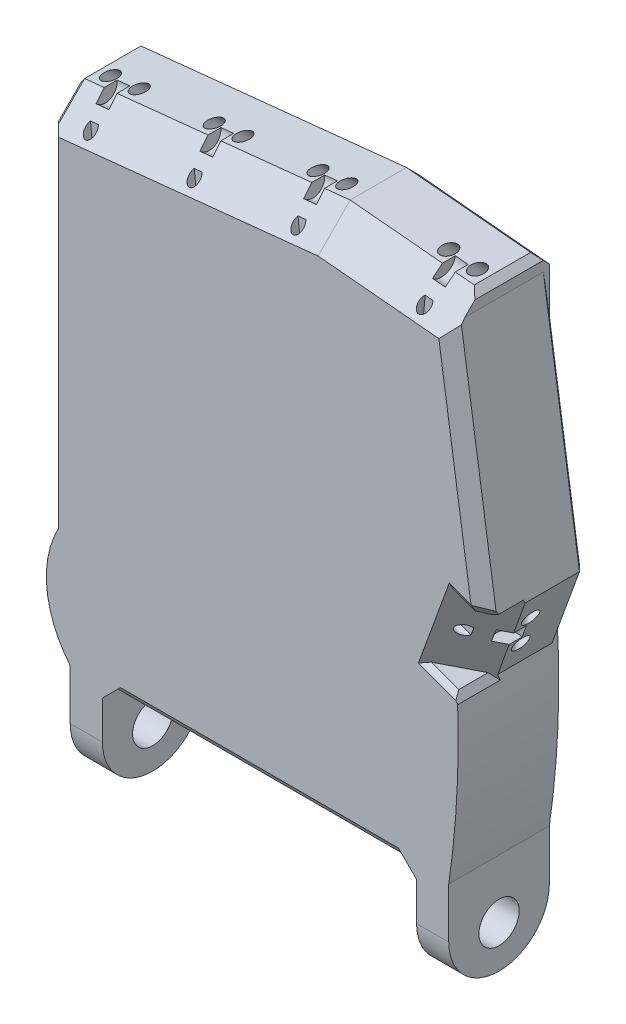
from build123d import *

# Parameters (mm, degrees)
SKETCH2_W                = 90
SKETCH2_H                = 120
BOSS_EXTRUDE1_DEPTH      = 12.5
SKETCH5_R                = 1.6
CUT_EXTRUDE1_DEPTH       = 156.95939029
SKETCH6_R                = 1.6
CUT_EXTRUDE2_DEPTH       = 155.009726207
SKETCH8_R                = 1.6
CUT_EXTRUDE3_DEPTH       = 162.607831264
CUT_EXTRUDE4_DEPTH       = 184.091912597
CUT_EXTRUDE5_DEPTH       = 180.168702353
CUT_EXTRUDE6_DEPTH       = 10.5
CUT_EXTRUDE7_DEPTH       = 6.3
CUT_EXTRUDE8_DEPTH       = 121.021740428
CUT_EXTRUDE9_DEPTH       = 157.064702034
CUT_EXTRUDE9_DEPTH_BACK  = 157.064702034
CUT_EXTRUDE10_DEPTH      = 155.490641088
CUT_EXTRUDE10_DEPTH_BACK = 155.490641088
CUT_EXTRUDE11_DEPTH      = 10
CUT_EXTRUDE11_DEPTH_BACK = 10
CUT_EXTRUDE12_DEPTH      = 163.134903098
CUT_EXTRUDE13_DEPTH      = 1.6
LPATTERN1_COUNT          = 3
LPATTERN1_PITCH          = 25.93099615
CUT_EXTRUDE14_DEPTH      = 1.6
CUT_EXTRUDE15_DEPTH      = 1.6
SKETCH27_R               = 5
CUT_EXTRUDE16_DEPTH      = 165.048282365
CHAMFER1_SIZE            = 3
CHAMFER2_SIZE            = 1.5
CHAMFER2_SIZE_2          = 1.659567856
CHAMFER2_SIZE_3          = 1.682528735
CHAMFER2_SIZE_4          = 1.622677659
CHAMFER3_SIZE            = 1.5
CHAMFER3_SIZE2           = 0.866025404
CHAMFER4_SIZE            = 1.228684906
CHAMFER4_SIZE_2          = 1.5
CHAMFER4_SIZE_3          = 0.866025404
CHAMFER4_SIZE_4          = 0.750246653
CHAMFER4_SIZE_5          = 0.762190103


with BuildPart() as part:
    # Sketch2 → Boss-Extrude1 (new, symmetric)
    with BuildSketch(Plane.XY):
        with Locations((45, 60)):
            Rectangle(SKETCH2_W, SKETCH2_H)
        with BuildLine():
            Line((-10, 120), (-10, 16.949135542))
            ThreePointArc((-10, 16.949135542), (-8.616450838, 7.92537499), (-4.085347876, 0))
            Line((-4.085347876, 0), (0, 0))
            Line((0, 0), (0, 120))
            Line((0, 120), (-10, 120))
        make_face()
        with BuildLine():
            ThreePointArc((92.159597133, 41.206147584), (92.047998407, 20.552330839), (90, 0))
            Line((90, 0), (90, 120))
            Line((90, 120), (99, 60))
            Line((99, 60), (92.159597133, 41.206147584))
        make_face()
        Polygon((90, 124), (90, 120), (0, 120), (-10, 120), (57.5, 127), align=None)
        Polygon((90, 0), (82, 0), (82, -25), (90, -25), (90, -2), align=None)
        Polygon((3.914652124, 0), (0, 0), (-4.085347876, 0), (-4.085347876, -2), (-4.085347876, -25), (3.914652124, -25), align=None)
    extrude(amount=BOSS_EXTRUDE1_DEPTH, both=True)

    # Sketch5 → Cut-Extrude1 (cut, through all)
    with BuildSketch(Plane(origin=(-6.441306417, 62.112597597, 62.445698079), x_dir=(0.9946657577296572, 0.10315052302381683, 0), z_dir=(-0.07293843431307986, 0.703334902304695, 0.7071067811865488))):
        with Locations(Location((6.831405186, 84.447592104, 0), (0, 0, 270))):
            Circle(SKETCH5_R)
        with Locations(Location((14.031405186, 84.447592104, 0), (0, 0, 270))):
            Circle(SKETCH5_R)
        with Locations(Location((32.76240134, 84.447592104, 0), (0, 0, 270))):
            Circle(SKETCH5_R)
        with Locations(Location((39.96240134, 84.447592104, 0), (0, 0, 270))):
            Circle(SKETCH5_R)
        with Locations(Location((58.693397493, 84.447592104, 0), (0, 0, 270))):
            Circle(SKETCH5_R)
        with Locations(Location((65.893397493, 84.447592104, 0), (0, 0, 270))):
            Circle(SKETCH5_R)
    extrude(amount=-CUT_EXTRUDE1_DEPTH, mode=Mode.SUBTRACT)

    # Sketch6 → Cut-Extrude2 (cut, through all)
    with BuildSketch(Plane(origin=(6.261729766, 67.835405795, 68.123795689), x_dir=(0.9957666790179708, -0.09191692421704345, 0), z_dir=(0.0649950804196813, 0.7041133712132142, 0.7071067811865487))):
        with Locations(Location((66.621302509, 92.477634753, 0), (0, 0, 270))):
            Circle(SKETCH6_R)
        with Locations(Location((73.821302509, 92.477634753, 0), (0, 0, 270))):
            Circle(SKETCH6_R)
    extrude(amount=-CUT_EXTRUDE2_DEPTH, mode=Mode.SUBTRACT)

    # Sketch8 → Cut-Extrude3 (cut, through all)
    with BuildSketch(Plane(origin=(35.242401598, -12.827185166, 37.504180429), x_dir=(-0.34202014332566816, -0.9396926207859086, 0), z_dir=(0.6644630243886737, -0.24184476264797442, 0.7071067811865488))):
        with Locations(Location((-83.841551436, 52.003386703, 0), (0, 0, 90))):
            Circle(SKETCH8_R)
        with Locations(Location((-76.641551436, 52.003386703, 0), (0, 0, 90))):
            Circle(SKETCH8_R)
    extrude(amount=-CUT_EXTRUDE3_DEPTH, mode=Mode.SUBTRACT)

    # Sketch9 → Cut-Extrude4 (cut, through all)
    with BuildSketch(Plane(origin=(-12.418435481, 119.749199283, 0), x_dir=(0.9946657577296573, 0.10315052302381666, 0), z_dir=(-0.10315052302381666, 0.9946657577296573, 0))):
        with BuildLine():
            Line((9.451609288, -9), (11.411201083, -9))
            ThreePointArc((11.411201083, -9), (11.831372787, -9.990475603), (11.424716354, -10.986576364))
            ThreePointArc((11.424716354, -10.986576364), (10.431405186, -11.4), (9.438094017, -10.986576364))
            ThreePointArc((9.438094017, -10.986576364), (9.031437584, -9.990475603), (9.451609288, -9))
        make_face()
        with BuildLine():
            Line((35.382605442, -9), (37.342197237, -9))
            ThreePointArc((37.342197237, -9), (37.762383115, -9.992856678), (37.352350833, -10.989949494))
            ThreePointArc((37.352350833, -10.989949494), (36.369544662, -11.399981776), (35.382605442, -11))
            ThreePointArc((35.382605442, -11), (34.96240134, -10), (35.382605442, -9))
        make_face()
        with BuildLine():
            Line((61.313601596, -9), (63.273193391, -9))
            ThreePointArc((63.273193391, -9), (63.693397493, -10), (63.273193391, -11))
            ThreePointArc((63.273193391, -11), (62.293397493, -11.4), (61.313601596, -11))
            ThreePointArc((61.313601596, -11), (60.893397493, -10), (61.313601596, -9))
        make_face()
    extrude(amount=-CUT_EXTRUDE4_DEPTH, mode=Mode.SUBTRACT)

    # Sketch10 → Cut-Extrude5 (cut, through all)
    with BuildSketch(Plane(origin=(12.109833372, 131.189861535, 0), x_dir=(0.9957666790179708, -0.09191692421704356, 0), z_dir=(0.09191692421704355, 0.9957666790179707, 0))):
        with BuildLine():
            Line((69.241506612, -9), (71.201098406, -9))
            ThreePointArc((71.201098406, -9), (71.621300734, -9.997770738), (71.204278093, -10.996874616))
            ThreePointArc((71.204278093, -10.996874616), (70.221302509, -11.4), (69.238326924, -10.996874616))
            ThreePointArc((69.238326924, -10.996874616), (68.821304284, -9.997770738), (69.241506612, -9))
        make_face()
    extrude(amount=-CUT_EXTRUDE5_DEPTH, mode=Mode.SUBTRACT)

    # Sketch11 → Cut-Extrude6 (cut)
    with BuildSketch(Plane(origin=(68.135571644, -24.799319973, 0), x_dir=(0, 0, -1), z_dir=(0.9396926207859085, -0.34202014332566827, 0))):
        with BuildLine():
            Line((-7.5, 81.221347334), (-7.5, 79.261755539))
            ThreePointArc((-7.5, 79.261755539), (-8.5, 78.841551436), (-9.5, 79.261755539))
            ThreePointArc((-9.5, 79.261755539), (-9.9, 80.241551436), (-9.5, 81.221347334))
            ThreePointArc((-9.5, 81.221347334), (-8.5, 81.641551436), (-7.5, 81.221347334))
        make_face()
    extrude(amount=-CUT_EXTRUDE6_DEPTH, mode=Mode.SUBTRACT)

    # Sketch12 → Cut-Extrude7 (cut)
    with BuildSketch(Plane(origin=(86.596580977, 53.872697603, 0), x_dir=(0, 0, 1), z_dir=(-0.8459502990860707, -0.5332617476213607, 0))):
        with BuildLine():
            Line((7.5, 1.584815358), (7.5, -0.374776437))
            ThreePointArc((7.5, -0.374776437), (8.5, -0.79498054), (9.5, -0.374776437))
            ThreePointArc((9.5, -0.374776437), (9.9, 0.60501946), (9.5, 1.584815358))
            ThreePointArc((9.5, 1.584815358), (8.5, 2.00501946), (7.5, 1.584815358))
        make_face()
    extrude(amount=CUT_EXTRUDE7_DEPTH, mode=Mode.SUBTRACT)

    # Sketch13 → Cut-Extrude8 (cut, through all)
    with BuildSketch(Plane(origin=(82.033004534, 50.995955609, 0), x_dir=(-0.9957666790179708, 0.09191692421704294, 0), z_dir=(-0.09191692421704294, -0.9957666790179708, 0))):
        with BuildLine():
            Line((-0.926141451, -7.5), (1.033450343, -7.5))
            ThreePointArc((1.033450343, -7.5), (1.453654446, -8.5), (1.033450343, -9.5))
            ThreePointArc((1.033450343, -9.5), (0.053654446, -9.9), (-0.926141451, -9.5))
            ThreePointArc((-0.926141451, -9.5), (-1.346345554, -8.5), (-0.926141451, -7.5))
        make_face()
    extrude(amount=CUT_EXTRUDE8_DEPTH, mode=Mode.SUBTRACT)

    # Sketch15 → Cut-Extrude9 (cut, two sides: drawn at the far end of the back side and taken through both)
    with BuildSketch(Plane(origin=(69.924033195, -6.454526141, 0), x_dir=(-0.09191692421704244, -0.9957666790179709, 0), z_dir=(-0.9957666790179708, 0.09191692421704242, 0)).offset(-CUT_EXTRUDE9_DEPTH_BACK)):
        Polygon((-131.747591378, 12.5), (-123.747591378, 12.5), (-131.747591378, 4.5), align=None)
    extrude(amount=CUT_EXTRUDE9_DEPTH + CUT_EXTRUDE9_DEPTH_BACK, mode=Mode.SUBTRACT)

    # Sketch17 → Cut-Extrude10 (cut, two sides: drawn at the far end of the back side and taken through both)
    with BuildSketch(Plane(origin=(10.375761543, 1.076004901, 0), x_dir=(0.10315052302381672, -0.9946657577296572, 0), z_dir=(-0.9946657577296572, -0.10315052302381673, 0)).offset(-CUT_EXTRUDE10_DEPTH_BACK)):
        Polygon((-120.391396158, 12.5), (-112.391396158, 12.5), (-120.391396158, 4.5), align=None)
    extrude(amount=CUT_EXTRUDE10_DEPTH + CUT_EXTRUDE10_DEPTH_BACK, mode=Mode.SUBTRACT)

    # Sketch19 → Cut-Extrude11 (cut, two sides: drawn at the far end of the back side and taken through both)
    with BuildSketch(Plane(origin=(27.444226923, 75.402393765, 0), x_dir=(-0.9396926207859088, 0.34202014332566816, 0), z_dir=(-0.34202014332566816, -0.9396926207859088, 0)).offset(-CUT_EXTRUDE11_DEPTH_BACK)):
        Polygon((-72.508360858, -12.5), (-62.508360858, -12.5), (-72.508360858, -2.5), align=None)
    extrude(amount=CUT_EXTRUDE11_DEPTH + CUT_EXTRUDE11_DEPTH_BACK, mode=Mode.SUBTRACT)

    # Sketch20 → Cut-Extrude12 (cut, through all)
    with BuildSketch(Plane(origin=(90, 0, 0), x_dir=(0, 0, -1), z_dir=(1, 0, 0))):
        with BuildLine():
            ThreePointArc((2e-08, -25), (-8.838834758, -21.338834772), (-12.5, -12.5))
            Line((-12.5, -12.5), (-12.5, -25))
            Line((-12.5, -25), (2e-08, -25))
        make_face()
        with BuildLine():
            ThreePointArc((12.5, -12.5), (8.838834772, -21.338834758), (2e-08, -25))
            Line((2e-08, -25), (12.5, -25))
            Line((12.5, -25), (12.5, -12.5))
        make_face()
    extrude(amount=-CUT_EXTRUDE12_DEPTH, mode=Mode.SUBTRACT)

    # Sketch22 → Cut-Extrude13 (cut, symmetric)
    with BuildSketch(Plane(origin=(10.375761543, 1.076004901, 0), x_dir=(0.10315052302381672, -0.9946657577296572, 0), z_dir=(-0.9946657577296572, -0.10315052302381673, 0))):
        with BuildLine():
            Line((-118.128654458, 6.7627417), (-120.391396158, 4.5))
            Line((-120.391396158, 4.5), (-120.391396158, 1.3))
            ThreePointArc((-120.391396158, 1.3), (-117.434981654, 3.275413016), (-118.128654458, 6.7627417))
        make_face()
    cut_extrude13 = extrude(amount=CUT_EXTRUDE13_DEPTH, both=True, mode=Mode.SUBTRACT)

    # LPattern1: Cut-Extrude13 ×3
    with Locations(*[Vector(0.9946657577296572, 0.10315052302381714, 0) * (i * LPATTERN1_PITCH) for i in range(1, LPATTERN1_COUNT)]):
        add(cut_extrude13, mode=Mode.SUBTRACT)

    # Sketch25 → Cut-Extrude14 (cut, symmetric)
    with BuildSketch(Plane(origin=(69.924033195, -6.454526141, 0), x_dir=(-0.09191692421704244, -0.9957666790179709, 0), z_dir=(-0.9957666790179708, 0.09191692421704242, 0))):
        with BuildLine():
            Line((-129.484849678, 6.7627417), (-131.747591378, 4.5))
            Line((-131.747591378, 4.5), (-131.747591378, 1.3))
            ThreePointArc((-131.747591378, 1.3), (-128.791176874, 3.275413016), (-129.484849678, 6.7627417))
        make_face()
    extrude(amount=CUT_EXTRUDE14_DEPTH, both=True, mode=Mode.SUBTRACT)

    # Sketch26 → Cut-Extrude15 (cut, symmetric)
    with BuildSketch(Plane(origin=(27.444226923, 75.402393765, 0), x_dir=(-0.9396926207859088, 0.34202014332566816, 0), z_dir=(-0.34202014332566816, -0.9396926207859088, 0))):
        with BuildLine():
            Line((-72.508360858, 0.7), (-72.508360858, -2.5))
            Line((-72.508360858, -2.5), (-70.245619158, -4.7627417))
            ThreePointArc((-70.245619158, -4.7627417), (-69.551946354, -1.275413016), (-72.508360858, 0.7))
        make_face()
    extrude(amount=CUT_EXTRUDE15_DEPTH, both=True, mode=Mode.SUBTRACT)

    # Sketch27 → Cut-Extrude16 (cut, through all)
    with BuildSketch(Plane.ZY.offset(4.085347876)):
        with Locations(Location((0, -14.5, 0), (0, 0, 270))):
            Circle(SKETCH27_R)
    extrude(amount=-CUT_EXTRUDE16_DEPTH, mode=Mode.SUBTRACT)

    # Chamfer1
    # the kernel refuses this chamfer: 3 mm, written as the material it adds along each edge
    with BuildSketch(Plane(origin=(82, 0, 12.5), x_dir=(0, -1, 0), z_dir=(0, 0, -1)), Plane(origin=(3.914652124, 0, 12.5), x_dir=(1, 0, 0), z_dir=(0, 0, -1))) as chamfer1_piece_1:
        Polygon((CHAMFER1_SIZE, 0), (0, CHAMFER1_SIZE), (0, 0), align=None)
    extrude(amount=25)
    # the kernel refuses this chamfer: 3 mm, written as the material it takes off along each edge
    with BuildSketch(Plane(origin=(34.452833944, 129.127430713, -12.5), x_dir=(-0.09191692421704341, -0.9957666790179708, 0), z_dir=(0.9957666790179708, -0.09191692421704342, 0))) as chamfer1_2_piece_1:
        Polygon((CHAMFER1_SIZE, 0), (0, -CHAMFER1_SIZE), (0, 0), align=None)
    extrude(amount=63.498363696, mode=Mode.SUBTRACT)
    with BuildSketch(Plane(origin=(89.46914369, 123.539042065, 12.5), x_dir=(0, 0, -1), z_dir=(0.14834045293024442, -0.9889363528682976, 0))) as chamfer1_2_piece_2:
        Polygon((CHAMFER1_SIZE, 0), (0, -CHAMFER1_SIZE), (0, 0), align=None)
    extrude(amount=71.964929031, mode=Mode.SUBTRACT)
    with BuildSketch(Plane(origin=(-17.673895024, 119.204188664, -12.5), x_dir=(0.10315052302381651, -0.9946657577296572, 0), z_dir=(0.9946657577296573, 0.10315052302381653, 0))) as chamfer1_2_piece_3:
        Polygon((CHAMFER1_SIZE, 0), (0, -CHAMFER1_SIZE), (0, 0), align=None)
    extrude(amount=98.722188164, mode=Mode.SUBTRACT)
    with BuildSketch(Plane(origin=(-10, 119.672146172, 12.5), x_dir=(0, 0, -1), z_dir=(0, -1, 0))) as chamfer1_2_piece_4_section:
        Polygon((CHAMFER1_SIZE, 0), (0, CHAMFER1_SIZE), (0, 0), align=None)
    chamfer1_2_piece_4 = extrude(amount=115.838593868, mode=Mode.PRIVATE)
    chamfer1_2_piece_4 = chamfer1_2_piece_4 - Plane(origin=(14.987616754, 16.162364314, 12.5), x_dir=(-0.9995046701515525, 0.031470849134337946, 0), z_dir=(0, 0, 1)) * Cylinder(25, 244, mode=Mode.PRIVATE)
    add(chamfer1_2_piece_4, mode=Mode.SUBTRACT)

    # Chamfer2
    # the kernel refuses this chamfer: 1.682528735, 1.659567856, 1.622677659, 1.5 mm, written as the material it takes off along each edge
    with BuildSketch(Plane(origin=(89.427773071, 123.814846192, -12.5), x_dir=(-0.9889363528682975, -0.1483404529302444, 0), z_dir=(0.14834045293024442, -0.9889363528682976, 0))) as chamfer2_piece_1_section:
        Polygon((CHAMFER2_SIZE, 0), (0, -CHAMFER2_SIZE), (0, 0), align=None)
    chamfer2_piece_1 = extrude(amount=68.386294212, mode=Mode.PRIVATE)
    chamfer2_piece_1 = split(chamfer2_piece_1, bisect_by=Plane(origin=(90, 123.814846192, -12.5), z_dir=(1, 0, 0)), keep=Keep.TOP, mode=Mode.PRIVATE)
    add(chamfer2_piece_1, mode=Mode.SUBTRACT)
    with BuildSketch(Plane(origin=(100.319351076, 63.62488729, -12.5), x_dir=(-0.9396926207859085, 0.3420201433256683, 0), z_dir=(-0.34202014332566827, -0.9396926207859085, 0))) as chamfer2_piece_2_section:
        Polygon((CHAMFER2_SIZE, 0), (0, -CHAMFER2_SIZE), (0, 0), align=None)
    chamfer2_piece_2 = extrude(amount=27.715048964, mode=Mode.PRIVATE)
    chamfer2_piece_2 = chamfer2_piece_2 - Plane(origin=(-127.650478494, 32.066637048, -12.5), x_dir=(0.9991367073954792, 0.041543229712201084, 0), z_dir=(0, 0, 1)) * Cylinder(220, 62, mode=Mode.PRIVATE)
    add(chamfer2_piece_2, mode=Mode.SUBTRACT)
    with BuildSketch(Plane(origin=(82.857524482, 0, -12.5), x_dir=(0, 1, 0), z_dir=(-1, 0, 0))) as chamfer2_piece_3_section:
        Polygon((CHAMFER2_SIZE, 0), (0, -CHAMFER2_SIZE), (0, 0), align=None)
    chamfer2_piece_3 = extrude(amount=79.80039684, mode=Mode.PRIVATE)
    chamfer2_piece_3 = split(chamfer2_piece_3, bisect_by=Plane(origin=(80.928762241, -1.928762241, -12.5), z_dir=(-0.7071067811865476, -0.7071067811865476, 0)), keep=Keep.TOP, mode=Mode.PRIVATE)
    chamfer2_piece_3 = split(chamfer2_piece_3, bisect_by=Plane(origin=(44.886088303, 37.971436179, -12.5), z_dir=(0.7071067811865476, -0.7071067811865476, 0)), keep=Keep.TOP, mode=Mode.PRIVATE)
    add(chamfer2_piece_3, mode=Mode.SUBTRACT)
    with BuildSketch(Plane(origin=(90, 124, -13.777873515), x_dir=(-0.9957666790179708, 0.09191692421704371, 0), z_dir=(0, 0, 1))) as chamfer2_piece_4:
        Polygon((CHAMFER2_SIZE_2, 0), (-CHAMFER2_SIZE * 0.091916924217, CHAMFER2_SIZE * 0.995766679018), (0, 0), align=None)
    extrude(amount=22.55574703, mode=Mode.SUBTRACT)
    with BuildSketch(Plane(origin=(-10, 120, 8.838228863), x_dir=(0.994665757729657, 0.10315052302381846, 0), z_dir=(0, 0, -1))) as chamfer2_piece_5:
        Polygon((CHAMFER2_SIZE, 0), (-CHAMFER2_SIZE_3 * 0.103150523018, CHAMFER2_SIZE_3 * 0.994665757675), (0, 0), align=None)
    extrude(amount=22.676457725, mode=Mode.SUBTRACT)
    # the kernel refuses this chamfer: 1.682528735, 1.659567856, 1.622677659, 1.5 mm, written as the material it takes off along each edge
    with BuildSketch(Plane(origin=(-10, 121.281669578, 3.225167159), x_dir=(1.0947071525708958e-15, -0.7052132765564088, -0.7089952288757478), z_dir=(0, -0.708995228875748, 0.7052132765564088))) as chamfer2_2_piece_1:
        Polygon((CHAMFER2_SIZE_4, 0), (-CHAMFER2_SIZE * 0.0729384343131, CHAMFER2_SIZE * 0.997336445138), (0, 0), align=None)
    extrude(amount=13.078624167, mode=Mode.SUBTRACT)
    with BuildSketch(Plane(origin=(-10, 114.019713141, -15.44838656), x_dir=(0, -0.7052132765564026, 0.708995228875754), z_dir=(0, 0.708995228875754, 0.7052132765564026))) as chamfer2_2_piece_2:
        Polygon((CHAMFER2_SIZE_4, 0), (-CHAMFER2_SIZE * 0.0729384343132, CHAMFER2_SIZE * 0.997336445138), (0, 0), align=None)
    extrude(amount=10.242602688, mode=Mode.SUBTRACT)
    # the kernel refuses this chamfer: 1.682528735, 1.659567856, 1.622677659, 1.5 mm, written as the material it takes off along each edge
    with BuildSketch(Plane(origin=(-10, 118.540461588, -12.5), x_dir=(1, 0, 0), z_dir=(0, -1, 0))) as chamfer2_3_piece_1_section:
        Polygon((CHAMFER2_SIZE, 0), (0, CHAMFER2_SIZE), (0, 0), align=None)
    chamfer2_3_piece_1 = extrude(amount=113.163899491, mode=Mode.PRIVATE)
    chamfer2_3_piece_1 = chamfer2_3_piece_1 - Plane(origin=(14.987616754, 16.162364314, -12.5), x_dir=(-0.9995046701515636, 0.03147084913398626, 0), z_dir=(0, 0, 1)) * Cylinder(25, 233, mode=Mode.PRIVATE)
    add(chamfer2_3_piece_1, mode=Mode.SUBTRACT)

    # Chamfer3
    chamfer3_edges = [part.edges().sort_by_distance(p)[0] for p in [
        (42.957326062, 0, 12.5),
    ]]
    chamfer3_side = [part.faces().sort_by_distance(p)[0] for p in [
        (42.049090342, 56.739831495, 12.5),
    ]]
    chamfer(chamfer3_edges, length=CHAMFER3_SIZE, length2=CHAMFER3_SIZE2, reference=chamfer3_side[0])

    # Chamfer4
    # the kernel refuses this chamfer: 1.5, 1.228684906, 0.866025404, 0.762190103, 0.750246653 mm, written as the material it takes off along each edge
    with BuildSketch(Plane(origin=(92.159597133, 41.206147584, -1.358522588), x_dir=(0.03815670230197311, -0.9992717678737044, 0), z_dir=(0, 0, 1))) as chamfer4_piece_1_section:
        with BuildLine():
            Line((1.491254466, 0), (-CHAMFER4_SIZE * 0.377626644879, -CHAMFER4_SIZE * 0.925957945696))
            Line((-CHAMFER4_SIZE * 0.377626644879, -CHAMFER4_SIZE * 0.925957945696), (0, 0))
            ThreePointArc((0, 0), (0.771555378, 0.001262021), (1.491254466, 0))
        make_face()
    chamfer4_piece_1 = extrude(amount=17.717045177, mode=Mode.PRIVATE)
    chamfer4_piece_1 = split(chamfer4_piece_1, bisect_by=Plane(origin=(93.972509735, 40.54630136, 0.570738706), z_dir=(0.6644630243886752, -0.24184476264797503, 0.7071067811865474)), keep=Keep.TOP, mode=Mode.PRIVATE)
    add(chamfer4_piece_1, mode=Mode.SUBTRACT)
    with BuildSketch(Plane(origin=(95.806195223, 39.878894423, 12.5), x_dir=(0, 0, -1), z_dir=(-0.9396926207859086, 0.3420201433256681, 0))) as chamfer4_piece_2_section:
        Polygon((CHAMFER4_SIZE_2, 0), (0, CHAMFER4_SIZE_3), (0, 0), align=None)
    chamfer4_piece_2 = extrude(amount=17.761257264, mode=Mode.PRIVATE)
    chamfer4_piece_2 = split(chamfer4_piece_2, bisect_by=Plane(origin=(89.284433074, 42.25262172, 5.559685684), z_dir=(0.6644630243886752, -0.24184476264797503, 0.7071067811865474)), keep=Keep.TOP, mode=Mode.PRIVATE)
    add(chamfer4_piece_2, mode=Mode.SUBTRACT)
    with BuildSketch(Plane(origin=(99.437852653, 59.840634667, 12.5), x_dir=(0, 0, -1), z_dir=(-0.9396926207859086, 0.3420201433256681, 0))) as chamfer4_piece_3_section:
        Polygon((CHAMFER4_SIZE_3, 0), (0, -CHAMFER4_SIZE_2), (0, 0), align=None)
    chamfer4_piece_3 = extrude(amount=14.346581693, mode=Mode.PRIVATE)
    chamfer4_piece_3 = split(chamfer4_piece_3, bisect_by=Plane(origin=(94.520463222, 61.63041805, 7.26702347), z_dir=(0.6644630243886752, -0.24184476264797503, 0.7071067811865474)), keep=Keep.TOP, mode=Mode.PRIVATE)
    add(chamfer4_piece_3, mode=Mode.SUBTRACT)
    with BuildSketch(Plane(origin=(99, 60, 13.380628632), x_dir=(-0.9396926207859109, 0.3420201433256619, 0), z_dir=(0, 0, -1))) as chamfer4_piece_4_section:
        Polygon((CHAMFER4_SIZE_2, 0), (CHAMFER4_SIZE_4 * 0.477630582411, CHAMFER4_SIZE_4 * 0.878560770762), (0, 0), align=None)
    chamfer4_piece_4 = extrude(amount=14.761257264, mode=Mode.PRIVATE)
    chamfer4_piece_4 = split(chamfer4_piece_4, bisect_by=Plane(origin=(93.887776783, 61.860697082, 7.940314316), z_dir=(0.6644630243886752, -0.24184476264797503, 0.7071067811865474)), keep=Keep.TOP, mode=Mode.PRIVATE)
    add(chamfer4_piece_4, mode=Mode.SUBTRACT)
    with BuildSketch(Plane(origin=(93.051749599, 62.164986092, 15.06128604), x_dir=(-0.6202143570232375, 0.22573956482105997, -0.7512494926565012), z_dir=(0.7059436046184719, -0.25694245915171204, -0.6600183329145861))) as chamfer4_piece_5:
        Polygon((CHAMFER4_SIZE_5, 0), (CHAMFER4_SIZE_2 * 0.337735823527, CHAMFER4_SIZE_2 * 0.941240943386), (0, 0), align=None)
    extrude(amount=12.306585553, mode=Mode.SUBTRACT)


solid = part.part
